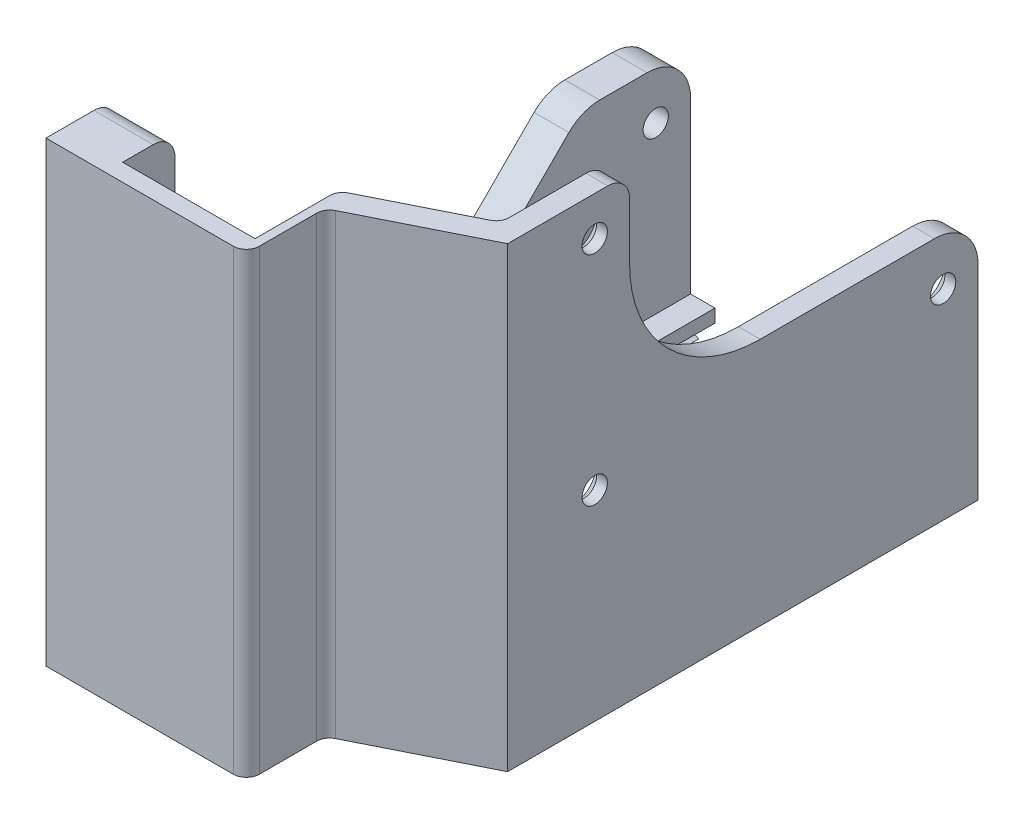
from build123d import *

# Parameters (mm, degrees)
EXTRUDE_1_DEPTH          = 105
SKETCH_7_W               = 30.4
SKETCH_7_H               = 19
EXTRUDE_2_DEPTH          = 3
SKETCH_8_W               = 30.4
SKETCH_8_H               = 12
EXTRUDE_3_DEPTH          = 38
FILLET_1_R               = 5
CUT_EXTRUDE_1_DEPTH      = 117
CUT_EXTRUDE_2_DEPTH      = 97
CUT_EXTRUDE_4_DEPTH      = 191.002631561
CUT_EXTRUDE_4_DEPTH_BACK = 6.8
SKETCH_11_R              = 5
FILLET_3_R               = 3
SKETCH_12_R              = 2.6
CUT_EXTRUDE_5_DEPTH      = 20
CHAMFER_1_SIZE           = 3
SKETCH_13_R              = 2.9
CUT_EXTRUDE_6_DEPTH      = 191.002631561
CHAMFER_3_SIZE           = 2.5
SKETCH_16_W              = 80
SKETCH_16_H              = 48
CUT_EXTRUDE_9_DEPTH      = 191.002631561
FILLET_4_R               = 30
SKETCH_17_W              = 28
SKETCH_17_H              = 52
CUT_EXTRUDE_10_DEPTH     = 20
FILLET_5_R               = 8
SKETCH_18_W              = 8
SKETCH_18_H              = 24
EXTRUDE_4_DEPTH          = 49
CHAMFER_4_SIZE           = 50
FILLET_6_R               = 10
SKETCH_19_R              = 2.9
CUT_EXTRUDE_11_DEPTH     = 191.002631561
CHAMFER_5_SIZE           = 2.6
SKETCH_21_R              = 2.3
CUT_EXTRUDE_13_DEPTH     = 15
FILLET_7_R               = 5
CHAMFER_6_SIZE           = 0.8
SKETCH_22_W              = 8
SKETCH_22_H              = 48.683816014
EXTRUDE_5_DEPTH          = 10
FILLET_8_R               = 10


with BuildPart() as part:
    # Эскиз2 → Бобышка-Вытянуть1 (new body)
    with BuildSketch(Plane(origin=(0, 0, 0), x_dir=(1, 0, 0), z_dir=(0, 1, 0))):
        Polygon((52.378939236, 0), (52.378939236, -108), (24.378939236, -122), (24.378939236, -140), (0, -140), (-21.621060764, -140), (-21.621060764, 0), (-8.021060764, 0), (-8.021060764, -136), (0, -136), (22.378939236, -136), (22.378939236, 0), align=None)
    extrude(amount=EXTRUDE_1_DEPTH)



with BuildPart() as body_2:
    # Эскиз7 → Бобышка-Вытянуть2 (new body)
    with BuildSketch(Plane.XZ):
        with Locations((7.178939236, 126.5)):
            Rectangle(SKETCH_7_W, SKETCH_7_H)
    extrude(amount=-EXTRUDE_2_DEPTH)


with BuildPart() as part_1:
    add(part.part)

    add(body_2.part)  # Бобышка-Вытянуть3 merges body 2
    # Эскиз8 → Бобышка-Вытянуть3 (add)
    with BuildSketch(Plane(origin=(0, 3, 0), x_dir=(1, 0, 0), z_dir=(0, 1, 0))):
        with Locations((7.178939236, -130)):
            Rectangle(SKETCH_8_W, SKETCH_8_H)
    extrude(amount=EXTRUDE_3_DEPTH)

    # Скругление1
    fillet_1_edges = [part_1.edges().sort_by_distance(p)[0] for p in [
        (7.178939236, 41, 124),
    ]]
    fillet(fillet_1_edges, radius=FILLET_1_R)

    # Эскиз3 → Вырез-Вытянуть1 (cut)
    with BuildSketch(Plane(origin=(0, 0, 0), x_dir=(-1, 0, 0), z_dir=(0, 0, -1))):
        Polygon((8.021060764, -1.66), (19.321060764, 3.4), (19.321060764, 5), (8.021060764, 5), align=None)
        Polygon((-33.678939236, 5), (-22.378939236, 5), (-22.378939236, -1.66), (-33.678939236, 3.4), align=None)
    extrude(amount=-CUT_EXTRUDE_1_DEPTH, mode=Mode.SUBTRACT)

    # Эскиз9 → Вырез-Вытянуть2 (cut)
    with BuildSketch(Plane(origin=(0, 105, 0), x_dir=(1, 0, 0), z_dir=(0, 1, 0))):
        Polygon((-21.621060764, 0), (-21.621060764, -96), (22.378939236, -96), (22.378939236, -117), (47.378939236, -104.5), (47.378939236, 0), align=None)
    extrude(amount=-CUT_EXTRUDE_2_DEPTH, mode=Mode.SUBTRACT)

    # Эскиз11 → Вырез-Вытянуть4 (cut, two sides: drawn at the far end of the back side and taken through both)
    with BuildSketch(Plane.ZY.offset(21.621060764).offset(-CUT_EXTRUDE_4_DEPTH_BACK)):
        with Locations(Location((103.6, 41.2, 0), (0, 0, 180))):
            Circle(SKETCH_11_R)
    extrude(amount=CUT_EXTRUDE_4_DEPTH + CUT_EXTRUDE_4_DEPTH_BACK, mode=Mode.SUBTRACT)

    # Скругление3
    fillet_3_edges = [part_1.edges().sort_by_distance(p)[0] for p in [
        (47.378939236, 56.5, 104.5),
        (22.378939236, 56.5, 117),
        (24.378939236, 52.5, 140),
        (24.378939236, 52.5, 122),
    ]]
    fillet(fillet_3_edges, radius=FILLET_3_R)

    # Эскиз12 → Вырез-Вытянуть5 (cut)
    with BuildSketch(Plane.ZY.offset(21.621060764)):
        with Locations((103.6, 41.2)):
            Circle(SKETCH_12_R)
    extrude(amount=-CUT_EXTRUDE_5_DEPTH, mode=Mode.SUBTRACT)

    # Фаска1
    # the kernel refuses this chamfer: 3 mm, written as the material it takes off along each edge
    with BuildSketch(Plane(origin=(-14.821060764, 41.2, 103.6), x_dir=(0, 0, 1), z_dir=(0, -1, 0))) as chamfer_1_piece_1_section:
        Polygon((2.6, -CHAMFER_1_SIZE), (2.6 + CHAMFER_1_SIZE, 0), (2.6, 0), align=None)
    chamfer_1_piece_1 = revolve(axis=Axis((-14.821060764, 41.2, 103.6), (-1, 0, 0)), mode=Mode.PRIVATE)
    chamfer_1_piece_1 = chamfer_1_piece_1 & Plane(origin=(-13.01179882, 41.2, 103.6), x_dir=(0, 0, -1), z_dir=(-1, 0, 0)) * Cylinder(5, 23, mode=Mode.PRIVATE)
    add(chamfer_1_piece_1, mode=Mode.SUBTRACT)

    # Эскиз13 → Вырез-Вытянуть6 (cut, through all)
    with BuildSketch(Plane.ZY.offset(21.621060764)):
        with Locations((88, 46)):
            Circle(SKETCH_13_R)
        with Locations((8, 46)):
            Circle(SKETCH_13_R)
        with Locations((88, 96)):
            Circle(SKETCH_13_R)
    extrude(amount=-CUT_EXTRUDE_6_DEPTH, mode=Mode.SUBTRACT)

    # Фаска3
    chamfer_3_edges = [part_1.edges().sort_by_distance(p)[0] for p in [
        (47.378939236, 96, 85.1),
        (47.378939236, 46, 5.1),
        (47.378939236, 46, 85.1),
    ]]
    chamfer(chamfer_3_edges, length=CHAMFER_3_SIZE)

    # Эскиз16 → Вырез-Вытянуть9 (cut, through all)
    with BuildSketch(Plane.ZY.offset(21.621060764)):
        with Locations((40, 81)):
            Rectangle(SKETCH_16_W, SKETCH_16_H)
    extrude(amount=-CUT_EXTRUDE_9_DEPTH, mode=Mode.SUBTRACT)

    # Скругление4
    fillet_4_edges = [part_1.edges().sort_by_distance(p)[0] for p in [
        (49.878939236, 57, 80),
    ]]
    fillet(fillet_4_edges, radius=FILLET_4_R)

    # Эскиз17 → Вырез-Вытянуть10 (cut)
    with BuildSketch(Plane.ZY.offset(21.621060764)):
        with Locations((110, 79)):
            Rectangle(SKETCH_17_W, SKETCH_17_H)
    extrude(amount=-CUT_EXTRUDE_10_DEPTH, mode=Mode.SUBTRACT)

    # Скругление5
    fillet_5_edges = [part_1.edges().sort_by_distance(p)[0] for p in [
        (-14.821060764, 53, 96),
        (-14.821060764, 53, 124),
    ]]
    fillet(fillet_5_edges, radius=FILLET_5_R)

    # Эскиз18 → Бобышка-Вытянуть4 (add)
    with BuildSketch(Plane(origin=(0, 8, 0), x_dir=(1, 0, 0), z_dir=(0, 1, 0))):
        with Locations((-17.621060764, -12)):
            Rectangle(SKETCH_18_W, SKETCH_18_H)
    extrude(amount=EXTRUDE_4_DEPTH)

    # Фаска4
    # the kernel refuses this chamfer: 50 mm, written as the material it adds along each edge
    with BuildSketch(Plane(origin=(-13.621060764, 8, 24), x_dir=(0, 0.9996219169112966, -0.027495876610586386), z_dir=(-1, 0, 0))) as chamfer_4_piece_1_section:
        Polygon((CHAMFER_4_SIZE * 0.999621916911, -CHAMFER_4_SIZE * 0.0274958766106), (-CHAMFER_4_SIZE * 0.0274958766106, -CHAMFER_4_SIZE * 0.999621916911), (0, 0), align=None)
    chamfer_4_piece_1 = extrude(amount=8, mode=Mode.PRIVATE)
    chamfer_4_piece_1 = split(chamfer_4_piece_1, bisect_by=Plane(origin=(-17.621060764, 57, 40.555220818), z_dir=(0, -1, 0)), keep=Keep.TOP, mode=Mode.PRIVATE)
    add(chamfer_4_piece_1)

    # Скругление6
    fillet_6_edges = [part_1.edges().sort_by_distance(p)[0] for p in [
        (49.878939236, 57, 0),
        (-17.621060764, 57, 0),
    ]]
    fillet(fillet_6_edges, radius=FILLET_6_R)

    # Эскиз19 → Вырез-Вытянуть11 (cut, through all)
    with BuildSketch(Plane(origin=(52.378939236, 0, 0), x_dir=(0, 0, -1), z_dir=(1, 0, 0))):
        with Locations(Location((-8, 46, 0), (0, 0, 180))):
            Circle(SKETCH_19_R)
    extrude(amount=-CUT_EXTRUDE_11_DEPTH, mode=Mode.SUBTRACT)

    # Фаска5
    chamfer_5_edges = [part_1.edges().sort_by_distance(p)[0] for p in [
        (-21.621060764, 46, 5.1),
    ]]
    chamfer(chamfer_5_edges, length=CHAMFER_5_SIZE)

    # Эскиз21 → Вырез-Вытянуть13 (cut)
    with BuildSketch(Plane.ZY.offset(21.621060764)):
        with Locations((130, 30)):
            Circle(SKETCH_21_R)
        with Locations((130, 90)):
            Circle(SKETCH_21_R)
    extrude(amount=-CUT_EXTRUDE_13_DEPTH, mode=Mode.SUBTRACT)

    # Скругление7
    fillet_7_edges = [part_1.edges().sort_by_distance(p)[0] for p in [
        (49.878939236, 105, 80),
        (-14.821060764, 105, 124),
    ]]
    fillet(fillet_7_edges, radius=FILLET_7_R)

    # Фаска6
    chamfer_6_edges = [part_1.edges().sort_by_distance(p)[0] for p in [
        (-21.621060764, 41.2, 108.6),
        (-21.621060764, 30, 127.7),
        (-21.621060764, 90, 127.7),
    ]]
    chamfer(chamfer_6_edges, length=CHAMFER_6_SIZE)

    # Эскиз22 → Бобышка-Вытянуть5 (add)
    with BuildSketch(Plane(origin=(0, 8, 0), x_dir=(1, 0, 0), z_dir=(0, 1, 0))):
        with Locations((-17.621060764, -71.658091993)):
            Rectangle(SKETCH_22_W, SKETCH_22_H)
    extrude(amount=EXTRUDE_5_DEPTH)

    # Скругление8
    fillet_8_edges = [part_1.edges().sort_by_distance(p)[0] for p in [
        (-17.621060764, 57, 25),
    ]]
    fillet(fillet_8_edges, radius=FILLET_8_R)


solid = part_1.part
